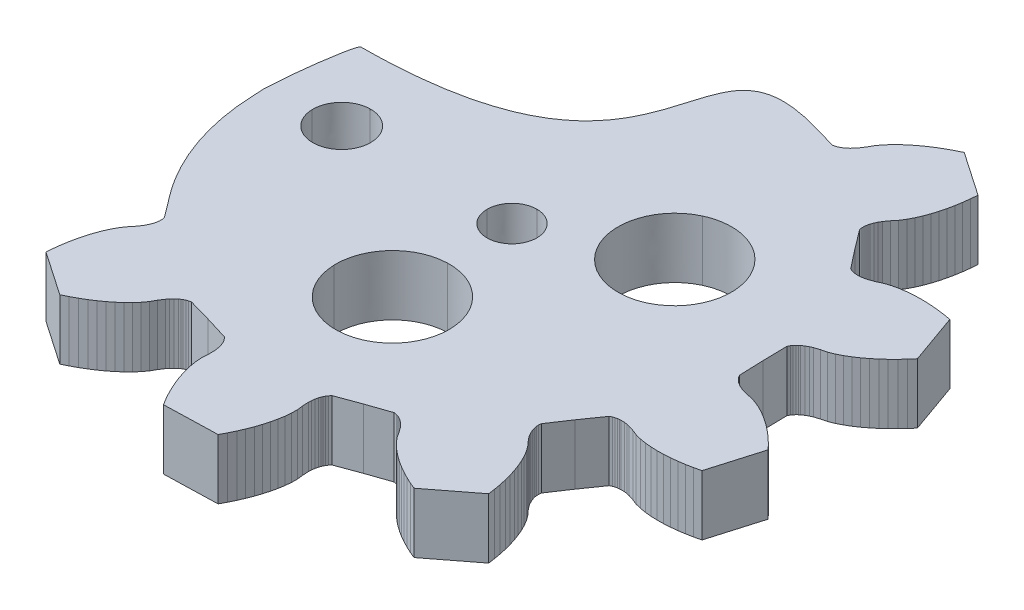
from build123d import *

# Parameters (mm, degrees)
BOSS_EXTRUDE1_DEPTH = 3.175


with BuildPart() as part:
    # Sketch1 → Boss-Extrude1 (new body)
    with BuildSketch(Plane(origin=(0, 0, 0), x_dir=(1, 0, 0), z_dir=(0, 1, 0))):
        with BuildLine():
            Line((10.703685091, 1.504584034), (10.681197418, 2.787485257))
            Line((10.681197418, 2.787485257), (10.742211712, 2.908714344))
            Line((10.742211712, 2.908714344), (10.806547855, 2.999921823))
            Line((10.806547855, 2.999921823), (10.872992141, 3.075063739))
            Line((10.872992141, 3.075063739), (10.940713498, 3.139257631))
            Line((10.940713498, 3.139257631), (11.009202561, 3.195521288))
            Line((11.009202561, 3.195521288), (11.148798197, 3.290752483))
            Line((11.148798197, 3.290752483), (11.290950413, 3.36845317))
            Line((11.290950413, 3.36845317), (11.435147406, 3.432461503))
            Line((11.435147406, 3.432461503), (11.728715483, 3.529362735))
            Line((11.728715483, 3.529362735), (12.025351943, 3.605725438))
            Line((12.025351943, 3.605725438), (12.315469001, 3.72042087))
            Line((12.315469001, 3.72042087), (12.600158505, 3.863213949))
            Line((12.600158505, 3.863213949), (12.879927383, 4.028850404))
            Line((12.879927383, 4.028850404), (13.155031537, 4.214273383))
            Line((13.155031537, 4.214273383), (13.425280869, 4.41781285))
            Line((13.425280869, 4.41781285), (13.690353674, 4.638052691))
            Line((13.690353674, 4.638052691), (13.950444924, 4.874670618))
            Line((13.950444924, 4.874670618), (14.204721111, 5.126270049))
            Line((14.204721111, 5.126270049), (14.453377208, 5.392977947))
            Line((14.453377208, 5.392977947), (14.695833171, 5.674022774))
            Line((14.695833171, 5.674022774), (13.753605281, 8.326882022))
            Line((13.753605281, 8.326882022), (13.388672293, 8.391329838))
            Line((13.388672293, 8.391329838), (13.027572957, 8.440678954))
            Line((13.027572957, 8.440678954), (12.671713515, 8.474919603))
            Line((12.671713515, 8.474919603), (12.321091529, 8.493807628))
            Line((12.321091529, 8.493807628), (11.976413776, 8.496747285))
            Line((11.976413776, 8.496747285), (11.638696551, 8.483308855))
            Line((11.638696551, 8.483308855), (11.308519898, 8.45296496))
            Line((11.308519898, 8.45296496), (10.987097523, 8.404387382))
            Line((10.987097523, 8.404387382), (10.67627923, 8.335075948))
            Line((10.67627923, 8.335075948), (10.379323501, 8.24053816))
            Line((10.379323501, 8.24053816), (10.100960864, 8.111701125))
            Line((10.100960864, 8.111701125), (9.812440146, 8.001224734))
            Line((9.812440146, 8.001224734), (9.66012741, 7.959688659))
            Line((9.66012741, 7.959688659), (9.501110049, 7.929920975))
            Line((9.501110049, 7.929920975), (9.332889972, 7.915398486))
            Line((9.332889972, 7.915398486), (9.244150549, 7.915584046))
            Line((9.244150549, 7.915584046), (9.151255768, 7.922693913))
            Line((9.151255768, 7.922693913), (9.052548362, 7.939013401))
            Line((9.052548362, 7.939013401), (8.944957508, 7.968771318))
            Line((8.944957508, 7.968771318), (8.821269214, 8.024077877))
            Line((8.821269214, 8.024077877), (8.029689479, 9.032848814))
            Line((8.029689479, 9.032848814), (7.25855264, 10.057753678))
            Line((7.25855264, 10.057753678), (7.237022771, 10.192030543))
            Line((7.237022771, 10.192030543), (7.235553164, 10.303590993))
            Line((7.235553164, 10.303590993), (7.245328611, 10.403373284))
            Line((7.245328611, 10.403373284), (7.262193757, 10.494961649))
            Line((7.262193757, 10.494961649), (7.284810599, 10.581178549))
            Line((7.284810599, 10.581178549), (7.341671973, 10.740291116))
            Line((7.341671973, 10.740291116), (7.411248009, 10.886863752))
            Line((7.411248009, 10.886863752), (7.490214422, 11.023513828))
            Line((7.490214422, 11.023513828), (7.670954188, 11.274790971))
            Line((7.670954188, 11.274790971), (7.866134126, 11.511360066))
            Line((7.866134126, 11.511360066), (8.033649864, 11.77499158))
            Line((8.033649864, 11.77499158), (8.180018366, 12.058214292))
            Line((8.180018366, 12.058214292), (8.309139089, 12.356857992))
            Line((8.309139089, 12.356857992), (8.4228594, 12.668871758))
            Line((8.4228594, 12.668871758), (8.52207861, 12.992546486))
            Line((8.52207861, 12.992546486), (8.60737189, 13.327100873))
            Line((8.60737189, 13.327100873), (8.679116998, 13.671441093))
            Line((8.679116998, 13.671441093), (8.737065345, 14.024873739))
            Line((8.737065345, 14.024873739), (8.781787226, 14.387008159))
            Line((8.781787226, 14.387008159), (8.812965811, 14.757150944))
            Line((8.812965811, 14.757150944), (6.494317838, 16.348491467))
            Line((6.494317838, 16.348491467), (6.161072801, 16.185726304))
            Line((6.161072801, 16.185726304), (5.840159792, 16.012979983))
            Line((5.840159792, 16.012979983), (5.532088178, 15.831209599))
            Line((5.532088178, 15.831209599), (5.237435566, 15.639770578))
            Line((5.237435566, 15.639770578), (4.956962348, 15.439502822))
            Line((4.956962348, 15.439502822), (4.691251008, 15.229761754))
            Line((4.691251008, 15.229761754), (4.442085545, 15.010801299))
            Line((4.442085545, 15.010801299), (4.210806397, 14.782172206))
            Line((4.210806397, 14.782172206), (3.999975019, 14.543054107))
            Line((3.999975019, 14.543054107), (3.814889797, 14.291581637))
            Line((3.814889797, 14.291581637), (3.665518714, 14.023594354))
            Line((3.665518714, 14.023594354), (3.496916003, 13.764377208))
            Line((3.496916003, 13.764377208), (3.398206159, 13.640980003))
            Line((3.398206159, 13.640980003), (3.286976626, 13.523208186))
            Line((3.286976626, 13.523208186), (3.159135412, 13.41235091))
            Line((3.159135412, 13.41235091), (3.087261134, 13.360316061))
            Line((3.087261134, 13.360316061), (3.008102185, 13.311347831))
            Line((3.008102185, 13.311347831), (2.918658423, 13.266354485))
            Line((2.918658423, 13.266354485), (2.814328489, 13.227123256))
            Line((2.814328489, 13.227123256), (2.681759185, 13.19902561))
            Line((2.681759185, 13.19902561), (1.449155898, 13.549196311))
            add(Edge.make_bspline(
                [(1.449155898, 13.549196311), (-6.944346694, 15.979061622), (2.096794541, 5.298830811), (-14.276278558, 5.232966882)],
                knots=[86, 86, 86, 86, 87, 87, 87, 87], degree=3))
            add(Edge.make_bspline(
                [(-14.276278558, 5.232966882), (-14.453377208, 5.21428395), (-14.852359754, 2.518609241), (-14.920083549, 0.787928027)],
                knots=[87, 87, 87, 87, 88, 88, 88, 88], degree=3))
            Line((-14.920083549, 0.787928027), (-14.884242678, 0.116455808))
            add(Edge.make_bspline(
                [(-14.884242678, 0.116455808), (-14.740937686, -3.433355119), (-13.180395059, -5.77598295), (-12.425036392, -6.739955867)],
                knots=[89, 89, 89, 89, 90, 90, 90, 90], degree=3))
            Line((-12.425036392, -6.739955867), (-11.653899553, -7.764855848))
            Line((-11.653899553, -7.764855848), (-11.632369684, -7.898883672))
            Line((-11.632369684, -7.898883672), (-11.631092612, -8.010698045))
            Line((-11.631092612, -8.010698045), (-11.640485426, -8.110289894))
            Line((-11.640485426, -8.110289894), (-11.657735642, -8.202068702))
            Line((-11.657735642, -8.202068702), (-11.680162386, -8.288285602))
            Line((-11.680162386, -8.288285602), (-11.737021323, -8.447398169))
            Line((-11.737021323, -8.447398169), (-11.806724092, -8.593970805))
            Line((-11.806724092, -8.593970805), (-11.885688067, -8.730747843))
            Line((-11.885688067, -8.730747843), (-12.066111003, -8.981839426))
            Line((-12.066111003, -8.981839426), (-12.261483476, -9.218462236))
            Line((-12.261483476, -9.218462236), (-12.428809115, -9.481903307))
            Line((-12.428809115, -9.481903307), (-12.575175181, -9.765252981))
            Line((-12.575175181, -9.765252981), (-12.704486002, -10.063896681))
            Line((-12.704486002, -10.063896681), (-12.81820875, -10.375788368))
            Line((-12.81820875, -10.375788368), (-12.917430397, -10.699653539))
            Line((-12.917430397, -10.699653539), (-13.002721239, -11.0340126))
            Line((-13.002721239, -11.0340126), (-13.074276249, -11.37835282))
            Line((-13.074276249, -11.37835282), (-13.132412258, -11.731980792))
            Line((-13.132412258, -11.731980792), (-13.176944041, -12.094115212))
            Line((-13.176944041, -12.094115212), (-13.208505259, -12.464253114))
            Line((-13.208505259, -12.464253114), (-10.889664751, -14.055530156))
            Line((-10.889664751, -14.055530156), (-10.556422151, -13.892642914))
            Line((-10.556422151, -13.892642914), (-10.235511579, -13.720087036))
            Line((-10.235511579, -13.720087036), (-9.927439965, -13.538121326))
            Line((-9.927439965, -13.538121326), (-9.632782478, -13.347068074))
            Line((-9.632782478, -13.347068074), (-9.352119163, -13.146604992))
            Line((-9.352119163, -13.146604992), (-9.086790456, -12.936863924))
            Line((-9.086790456, -12.936863924), (-8.837434895, -12.717903469))
            Line((-8.837434895, -12.717903469), (-8.606158184, -12.489279259))
            Line((-8.606158184, -12.489279259), (-8.395134271, -12.250351603))
            Line((-8.395134271, -12.250351603), (-8.210431683, -11.998493364))
            Line((-8.210431683, -11.998493364), (-8.060673091, -11.730701407))
            Line((-8.060673091, -11.730701407), (-7.892265353, -11.471479378))
            Line((-7.892265353, -11.471479378), (-7.793555509, -11.348082172))
            Line((-7.793555509, -11.348082172), (-7.68213344, -11.230310356))
            Line((-7.68213344, -11.230310356), (-7.55467486, -11.119457963))
            Line((-7.55467486, -11.119457963), (-7.482608047, -11.067423114))
            Line((-7.482608047, -11.067423114), (-7.403259, -11.018396286))
            Line((-7.403259, -11.018396286), (-7.314005336, -10.973398057))
            Line((-7.314005336, -10.973398057), (-7.209485303, -10.934420752))
            Line((-7.209485303, -10.934420752), (-7.077108535, -10.90612778))
            Line((-7.077108535, -10.90612778), (-5.844505248, -11.256108038))
            Line((-5.844505248, -11.256108038), (-4.619374292, -11.631490444))
            Line((-4.619374292, -11.631490444), (-4.523350199, -11.726921849))
            Line((-4.523350199, -11.726921849), (-4.456586645, -11.816527655))
            Line((-4.456586645, -11.816527655), (-4.405859602, -11.902871517))
            Line((-4.405859602, -11.902871517), (-4.365802445, -11.987227937))
            Line((-4.365802445, -11.987227937), (-4.333407717, -12.07017801))
            Line((-4.333407717, -12.07017801), (-4.286321791, -12.232366961))
            Line((-4.286321791, -12.232366961), (-4.256612814, -12.391992258))
            Line((-4.256612814, -12.391992258), (-4.240322838, -12.549122265))
            Line((-4.240322838, -12.549122265), (-4.239045767, -12.858455182))
            Line((-4.239045767, -12.858455182), (-4.258274957, -13.164911922))
            Line((-4.258274957, -13.164911922), (-4.239045767, -13.476613166))
            Line((-4.239045767, -13.476613166), (-4.191257938, -13.792089086))
            Line((-4.191257938, -13.792089086), (-4.120594929, -14.109806371))
            Line((-4.120594929, -14.109806371), (-4.029489024, -14.429125329))
            Line((-4.029489024, -14.429125329), (-3.919919196, -14.74953323))
            Line((-3.919919196, -14.74953323), (-3.792655589, -15.070448979))
            Line((-3.792655589, -15.070448979), (-3.648458596, -15.391242649))
            Line((-3.648458596, -15.391242649), (-3.488034993, -15.711455223))
            Line((-3.488034993, -15.711455223), (-3.311638245, -16.030578856))
            Line((-3.311638245, -16.030578856), (-3.119843522, -16.348491467))
            Line((-3.119843522, -16.348491467), (-0.310210222, -16.270468493))
            Line((-0.310210222, -16.270468493), (-0.136370055, -15.942638204))
            Line((-0.136370055, -15.942638204), (0.022074574, -15.61404126))
            Line((0.022074574, -15.61404126), (0.164609424, -15.285312471))
            Line((0.164609424, -15.285312471), (0.290854298, -14.957096413))
            Line((0.290854298, -14.957096413), (0.40023159, -14.629778855))
            Line((0.40023159, -14.629778855), (0.492039398, -14.303740682))
            Line((0.492039398, -14.303740682), (0.565064015, -13.979880393))
            Line((0.565064015, -13.979880393), (0.618284272, -13.658578876))
            Line((0.618284272, -13.658578876), (0.648502616, -13.341115515))
            Line((0.648502616, -13.341115515), (0.650547393, -13.028642733))
            Line((0.650547393, -13.028642733), (0.614321451, -12.723856029))
            Line((0.614321451, -12.723856029), (0.598540841, -12.414908882))
            Line((0.598540841, -12.414908882), (0.60614478, -12.256880375))
            Line((0.60614478, -12.256880375), (0.626972747, -12.096102654))
            Line((0.626972747, -12.096102654), (0.664985127, -11.931159607))
            Line((0.664985127, -11.931159607), (0.692905229, -11.846803187))
            Line((0.692905229, -11.846803187), (0.728236734, -11.760459325))
            Line((0.728236734, -11.760459325), (0.774043151, -11.671366249))
            Line((0.774043151, -11.671366249), (0.835632615, -11.578303173))
            Line((0.835632615, -11.578303173), (0.926353449, -11.477431939))
            Line((0.926353449, -11.477431939), (2.128867562, -11.03509666))
            Line((2.128867562, -11.03509666), (3.340067712, -10.617084353))
            Line((3.340067712, -10.617084353), (3.473916525, -10.637950054))
            Line((3.473916525, -10.637950054), (3.580354603, -10.670979682))
            Line((3.580354603, -10.670979682), (3.672225776, -10.71110941))
            Line((3.672225776, -10.71110941), (3.754068037, -10.755721871))
            Line((3.754068037, -10.755721871), (3.82888153, -10.803596275))
            Line((3.82888153, -10.803596275), (3.962345272, -10.907216723))
            Line((3.962345272, -10.907216723), (4.079835868, -11.018777172))
            Line((4.079835868, -11.018777172), (4.185252776, -11.136353663))
            Line((4.185252776, -11.136353663), (4.367973953, -11.385843574))
            Line((4.367973953, -11.385843574), (4.532038672, -11.644870276))
            Line((4.532038672, -11.644870276), (4.730542896, -11.886039299))
            Line((4.730542896, -11.886039299), (4.954215668, -12.112998354))
            Line((4.954215668, -12.112998354), (5.197951139, -12.328374577))
            Line((5.197951139, -12.328374577), (5.458936827, -12.533188547))
            Line((5.458936827, -12.533188547), (5.735703124, -12.727826031))
            Line((5.735703124, -12.727826031), (6.026907156, -12.912350511))
            Line((6.026907156, -12.912350511), (6.331656921, -13.087079392))
            Line((6.331656921, -13.087079392), (6.649311447, -13.251636671))
            Line((6.649311447, -13.251636671), (6.979103029, -13.406207907))
            Line((6.979103029, -13.406207907), (7.320844005, -13.550280371))
            Line((7.320844005, -13.550280371), (9.548066805, -11.832852027))
            Line((9.548066805, -11.832852027), (9.496445324, -11.464887126))
            Line((9.496445324, -11.464887126), (9.431789914, -11.105887689))
            Line((9.431789914, -11.105887689), (9.354422278, -10.756039276))
            Line((9.354422278, -10.756039276), (9.263891542, -10.416240385))
            Line((9.263891542, -10.416240385), (9.160136778, -10.086935385))
            Line((9.160136778, -10.086935385), (9.043155547, -9.76928158))
            Line((9.043155547, -9.76928158), (8.912375118, -9.463918665))
            Line((8.912375118, -9.463918665), (8.76696442, -9.173083122))
            Line((8.76696442, -9.173083122), (8.60507121, -8.898249662))
            Line((8.60507121, -8.898249662), (8.423371203, -8.644403982))
            Line((8.423371203, -8.644403982), (8.215286504, -8.419046599))
            Line((8.215286504, -8.419046599), (8.021001004, -8.178326827))
            Line((8.021001004, -8.178326827), (7.934623188, -8.046218081))
            Line((7.934623188, -8.046218081), (7.857253115, -7.903810771))
            Line((7.857253115, -7.903810771), (7.791383999, -7.747960149))
            Line((7.791383999, -7.747960149), (7.764168236, -7.663217961))
            Line((7.764168236, -7.663217961), (7.742253296, -7.572713655))
            Line((7.742253296, -7.572713655), (7.727047856, -7.473444094))
            Line((7.727047856, -7.473444094), (7.722193034, -7.36207897))
            Line((7.722193034, -7.36207897), (7.736504036, -7.227094049))
            Line((7.736504036, -7.227094049), (8.449692528, -6.160843552))
            Line((8.449692528, -6.160843552), (9.184413326, -5.109633157))
            Line((9.184413326, -5.109633157), (9.305035673, -5.047548785))
            Line((9.305035673, -5.047548785), (9.410386777, -5.011833425))
            Line((9.410386777, -5.011833425), (9.508202183, -4.990074107))
            Line((9.508202183, -4.990074107), (9.60058516, -4.97791018))
            Line((9.60058516, -4.97791018), (9.689134485, -4.972792639))
            Line((9.689134485, -4.972792639), (9.857927294, -4.97791018))
            Line((9.857927294, -4.97791018), (10.018543433, -4.998775881))
            Line((10.018543433, -4.998775881), (10.172835141, -5.031932471))
            Line((10.172835141, -5.031932471), (10.466978388, -5.126274933))
            Line((10.466978388, -5.126274933), (10.751987159, -5.239178249))
            Line((10.751987159, -5.239178249), (11.053924442, -5.317328185))
            Line((11.053924442, -5.317328185), (11.36812795, -5.369045629))
            Line((11.36812795, -5.369045629), (11.691597539, -5.400082932))
            Line((11.691597539, -5.400082932), (12.022795362, -5.412056416))
            Line((12.022795362, -5.412056416), (12.360766052, -5.406611703))
            Line((12.360766052, -5.406611703), (12.704678537, -5.384466617))
            Line((12.704678537, -5.384466617), (13.053830916, -5.346192486))
            Line((13.053830916, -5.346192486), (13.407518849, -5.29230204))
            Line((13.407518849, -5.29230204), (13.764977068, -5.222985723))
            Line((13.764977068, -5.222985723), (14.125947234, -5.138433977))
            Line((14.125947234, -5.138433977), (14.920083549, -2.437319439))
            Line((14.920083549, -2.437319439), (14.66254888, -2.170421098))
            Line((14.66254888, -2.170421098), (14.399581781, -1.917923167))
            Line((14.399581781, -1.917923167), (14.131762297, -1.680401858))
            Line((14.131762297, -1.680401858), (13.859019751, -1.458882632))
            Line((13.859019751, -1.458882632), (13.581934186, -1.253492451))
            Line((13.581934186, -1.253492451), (13.30082487, -1.065383739))
            Line((13.30082487, -1.065383739), (13.015945268, -0.895518476))
            Line((13.015945268, -0.895518476), (12.727680451, -0.745683895))
            Line((12.727680451, -0.745683895), (12.43532608, -0.618697573))
            Line((12.43532608, -0.618697573), (12.139457325, -0.520321629))
            Line((12.139457325, -0.520321629), (11.838987212, -0.460478624))
            Line((11.838987212, -0.460478624), (11.540691046, -0.380092205))
            Line((11.540691046, -0.380092205), (11.393108838, -0.324214317))
            Line((11.393108838, -0.324214317), (11.246803701, -0.254385269))
            Line((11.246803701, -0.254385269), (11.10228744, -0.16708431))
            Line((11.10228744, -0.16708431), (11.030539895, -0.114663692))
            Line((11.030539895, -0.114663692), (10.959560054, -0.054244475))
            Line((10.959560054, -0.054244475), (10.889092018, 0.017059285))
            Line((10.889092018, 0.017059285), (10.819771883, 0.104487206))
            Line((10.819771883, 0.104487206), (10.751987159, 0.221873254))
            Line((10.751987159, 0.221873254), (10.703685091, 1.504584034))
        make_face()
        with BuildLine():
            add(Edge.make_bspline(
                [(-2.197675894, 2.462345584), (-2.923003878, 2.462345584), (-3.511032031, 1.873056783), (-3.511032031, 1.146478214)],
                knots=[3, 3, 3, 3, 4, 4, 4, 4], degree=3))
            add(Edge.make_bspline(
                [(-3.511032031, 1.146478214), (-3.511032031, 0.419836164), (-2.923003878, -0.169257311), (-2.197675894, -0.169257311)],
                knots=[0, 0, 0, 0, 1, 1, 1, 1], degree=3))
            add(Edge.make_bspline(
                [(-2.197675894, -0.169257311), (-1.472347909, -0.169452637), (-0.884124783, 0.419836164), (-0.884124783, 1.146478214), (-0.884124783, 1.873056783), (-1.472347909, 2.462150258), (-2.197675894, 2.462345584)],
                knots=[1, 1, 1, 1, 2, 2, 2, 3, 3, 3, 3], degree=3))
        make_face(mode=Mode.SUBTRACT)
        with BuildLine():
            add(Edge.make_bspline(
                [(-12.692539045, 1.085482785), (-12.709340824, 1.930214057), (-12.039087775, 2.628890305), (-11.195884123, 2.645590679)],
                knots=[3, 3, 3, 3, 4, 4, 4, 4], degree=3))
            add(Edge.make_bspline(
                [(-11.195884123, 2.645590679), (-10.352490372, 2.662486379), (-9.655462686, 1.991019043), (-9.638597541, 1.146478214)],
                knots=[0, 0, 0, 0, 1, 1, 1, 1], degree=3))
            add(Edge.make_bspline(
                [(-9.638597541, 1.146478214), (-9.621732395, 0.3015565), (-10.291858712, -0.396987904), (-11.135062364, -0.413820122)],
                knots=[1, 1, 1, 1, 2, 2, 2, 2], degree=3))
            add(Edge.make_bspline(
                [(-11.135062364, -0.413820122), (-11.978456115, -0.430525379), (-12.675673899, 0.240561071), (-12.692539045, 1.085482785)],
                knots=[2, 2, 2, 2, 3, 3, 3, 3], degree=3))
        make_face(mode=Mode.SUBTRACT)
        with BuildLine():
            add(Edge.make_bspline(
                [(0.987879547, -5.262348796), (1.043717314, -6.918078537), (-0.251177339, -8.305884476), (-1.90410538, -8.361762364)],
                knots=[3, 3, 3, 3, 4, 4, 4, 4], degree=3))
            add(Edge.make_bspline(
                [(-1.90410538, -8.361762364), (-3.557035859, -8.417640252), (-4.942078613, -7.120397217), (-4.997660478, -5.464472149)],
                knots=[0, 0, 0, 0, 1, 1, 1, 1], degree=3))
            add(Edge.make_bspline(
                [(-4.997660478, -5.464472149), (-5.053432442, -3.808551965), (-3.758793691, -2.420999951), (-2.105868086, -2.365122063)],
                knots=[1, 1, 1, 1, 2, 2, 2, 2], degree=3))
            add(Edge.make_bspline(
                [(-2.105868086, -2.365122063), (-0.452937608, -2.309249058), (0.932105147, -3.60648721), (0.987879547, -5.262348796)],
                knots=[2, 2, 2, 2, 3, 3, 3, 3], degree=3))
        make_face(mode=Mode.SUBTRACT)
        with BuildLine():
            add(Edge.make_bspline(
                [(2.479297013, 6.522206433), (3.977740811, 7.22216695), (5.759214405, 6.572834934), (6.458091895, 5.07149087)],
                knots=[3, 3, 3, 3, 4, 4, 4, 4], degree=3))
            add(Edge.make_bspline(
                [(6.458091895, 5.07149087), (7.156779286, 3.570195637), (6.508436304, 1.785819304), (5.009799971, 1.085673227)],
                knots=[0, 0, 0, 0, 1, 1, 1, 1], degree=3))
            add(Edge.make_bspline(
                [(5.009799971, 1.085673227), (3.511353737, 0.385722476), (1.730075115, 1.035049609), (1.031195188, 2.53640344), (0.332317698, 4.037747504), (0.980660681, 5.822255682), (2.479297013, 6.522206433)],
                knots=[1, 1, 1, 1, 2, 2, 2, 3, 3, 3, 3], degree=3))
        make_face(mode=Mode.SUBTRACT)
    extrude(amount=BOSS_EXTRUDE1_DEPTH)


solid = part.part
